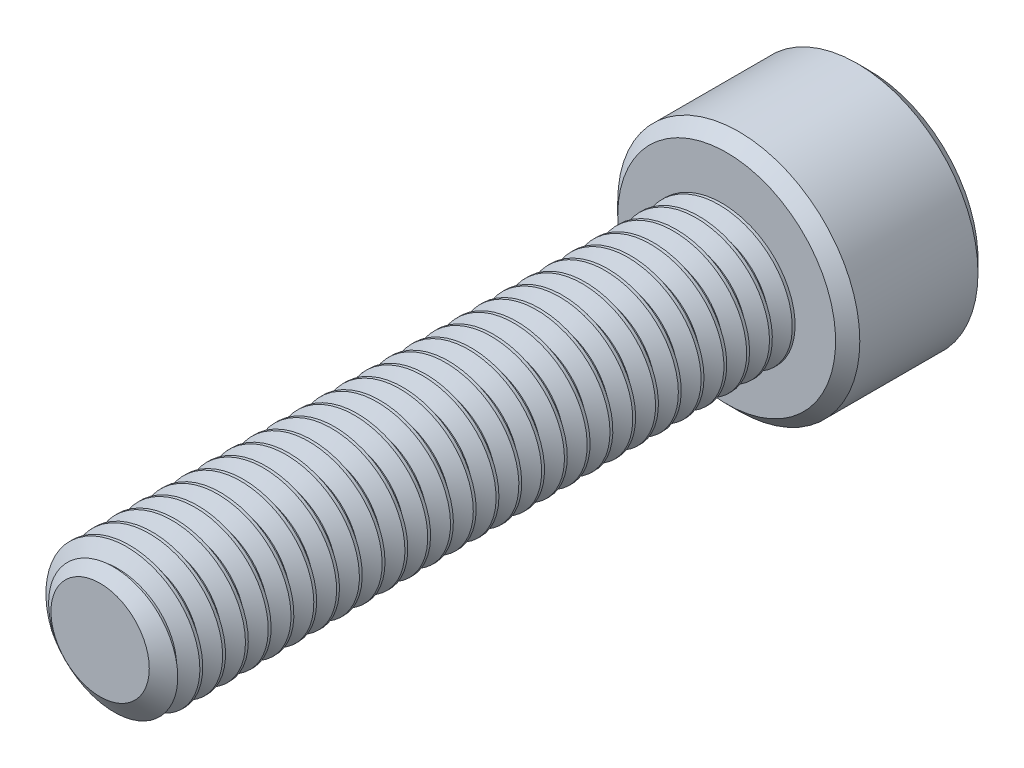
from build123d import *

# Parameters (mm, degrees)
SKETCH1_R          = 2.5
EXTRUDE1_DEPTH     = 22
CUT_SWEEP1_PITCH   = 0.8
SKETCH6_R          = 4.25
EXTRUDE2_DEPTH     = 5
CUT_EXTRUDE1_DEPTH = 3
CHAMFER1_SIZE      = 0.425


with BuildPart() as part:
    # Sketch1 → Extrude1 (new body)
    with BuildSketch(Plane.XY):
        Circle(SKETCH1_R)
    extrude(amount=-EXTRUDE1_DEPTH)

    # Cut-Sweep1: the profile of Sketch3 profile screwed along a right-hand helix of 28.5 turns, 6 arcs to a turn; built about Z, then put on its axis
    cut_sweep1_z = Axis((0, 0, 0), (0, 0, 1))
    cut_sweep1_corners = [(2.5003, 0, -0.700173205), (1.980384758, 0, -0.4), (1.980384758, 0, -0.3), (2.5003, 0, 0.000173205)]
    with BuildLine(mode=Mode.PRIVATE) as cut_sweep1_profile:
        Line(cut_sweep1_corners[0], cut_sweep1_corners[1])
        Line(cut_sweep1_corners[1], cut_sweep1_corners[2])
        Line(cut_sweep1_corners[2], cut_sweep1_corners[3])
        Line(cut_sweep1_corners[3], cut_sweep1_corners[0])
    cut_sweep1_cap = Face(cut_sweep1_profile.wire())
    cut_sweep1_turn_angles = [0, 30, 60, 90, 120, 150, 180, 210, 240, 270, 300, 330, 360]
    cut_sweep1_turn_weights = [1, 0.8660254037844387, 1, 0.8660254037844387, 1, 0.8660254037844387, 1, 0.8660254037844387, 1, 0.8660254037844387, 1, 0.8660254037844387, 1]
    cut_sweep1_turn_rails = [Edge.make_bspline([Vector(p[0], p[1], 0).rotate(cut_sweep1_z, cut_sweep1_turn_angles[k]) / cut_sweep1_turn_weights[k] + Vector(0, 0, p[2] + CUT_SWEEP1_PITCH * cut_sweep1_turn_angles[k] / 360) for k in range(13)], [0, 0, 0, 1, 1, 2, 2, 3, 3, 4, 4, 5, 5, 6, 6, 6], 2, cut_sweep1_turn_weights) for p in cut_sweep1_corners]
    cut_sweep1_turn_sides = [Face.make_surface_from_curves(cut_sweep1_turn_rails[p[0]], cut_sweep1_turn_rails[p[1]]) for p in [(0, 1), (1, 2), (2, 3), (3, 0)]]
    cut_sweep1_last_angles = [10080, 10110, 10140, 10170, 10200, 10230, 10260]
    cut_sweep1_last_weights = [1, 0.8660254037844387, 1, 0.8660254037844387, 1, 0.8660254037849149, 1]
    cut_sweep1_last_rails = [Edge.make_bspline([Vector(p[0], p[1], 0).rotate(cut_sweep1_z, cut_sweep1_last_angles[k]) / cut_sweep1_last_weights[k] + Vector(0, 0, p[2] + CUT_SWEEP1_PITCH * cut_sweep1_last_angles[k] / 360) for k in range(7)], [0, 0, 0, 1, 1, 2, 2, 3, 3, 3], 2, cut_sweep1_last_weights) for p in cut_sweep1_corners]
    cut_sweep1_last_sides = [Face.make_surface_from_curves(cut_sweep1_last_rails[p[0]], cut_sweep1_last_rails[p[1]]) for p in [(0, 1), (1, 2), (2, 3), (3, 0)]]
    cut_sweep1 = Plane(origin=(0, 0, 0), x_dir=(0, 1, 0), z_dir=(0, 0, -1)) * Solid(Shell([*[p.moved(Location((0, 0, CUT_SWEEP1_PITCH * i))) for i in range(28) for p in cut_sweep1_turn_sides], *cut_sweep1_last_sides, cut_sweep1_cap, cut_sweep1_cap.rotate(cut_sweep1_z, 10260).moved(Location((0, 0, CUT_SWEEP1_PITCH * 10260 / 360)))]))
    add(cut_sweep1, mode=Mode.SUBTRACT)

    # Sketch4 → Cut-Revolve1 (revolve, cut)
    with BuildSketch(Plane(origin=(0, 0, 0), x_dir=(0, 0, -1), z_dir=(1, 0, 0)), mode=Mode.PRIVATE) as cut_revolve1_sk:
        Polygon((0.541691224, 2.5), (0, 1.726384758), (0, 2.5), align=None)
    revolve(cut_revolve1_sk.sketch.rotate(Axis((0, 0, 0), (0, 0, -1)), 260.43858876), axis=Axis((0, 0, 0), (0, 0, -1)), mode=Mode.SUBTRACT)

    # Sketch6 → Extrude2 (add)
    with BuildSketch(Plane(origin=(0, 0, -22), x_dir=(-1, 0, 0), z_dir=(0, 0, -1))):
        Circle(SKETCH6_R)
    extrude(amount=EXTRUDE2_DEPTH)

    # Sketch7 → Cut-Extrude1 (cut)
    with BuildSketch(Plane(origin=(0, 0, -27), x_dir=(-1, 0, 0), z_dir=(0, 0, -1))):
        Polygon((0, 2.309401077), (-2, 1.154700538), (-2, -1.154700538), (0, -2.309401077), (2, -1.154700538), (2, 1.154700538), align=None)
    extrude(amount=-CUT_EXTRUDE1_DEPTH, mode=Mode.SUBTRACT)

    # Cut-Extrude2 cone 1 section (through the dimple's axis) → Cut-Extrude2 (revolve, cut)
    with BuildSketch(Plane(origin=(0, 0, -27), x_dir=(0, 1, 0), z_dir=(1, 0, 0))):
        Polygon((0, 0), (2.309401077, 0), (0, 2.309401077), align=None)
    revolve(axis=Axis((0, 0, -27), (0, 0, 1)), mode=Mode.SUBTRACT)

    # Chamfer1
    chamfer1_edges = [part.edges().sort_by_distance(p)[0] for p in [
        (4.25, 0, -22),
        (4.25, 0, -27),
    ]]
    chamfer(chamfer1_edges, length=CHAMFER1_SIZE)


solid = part.part
